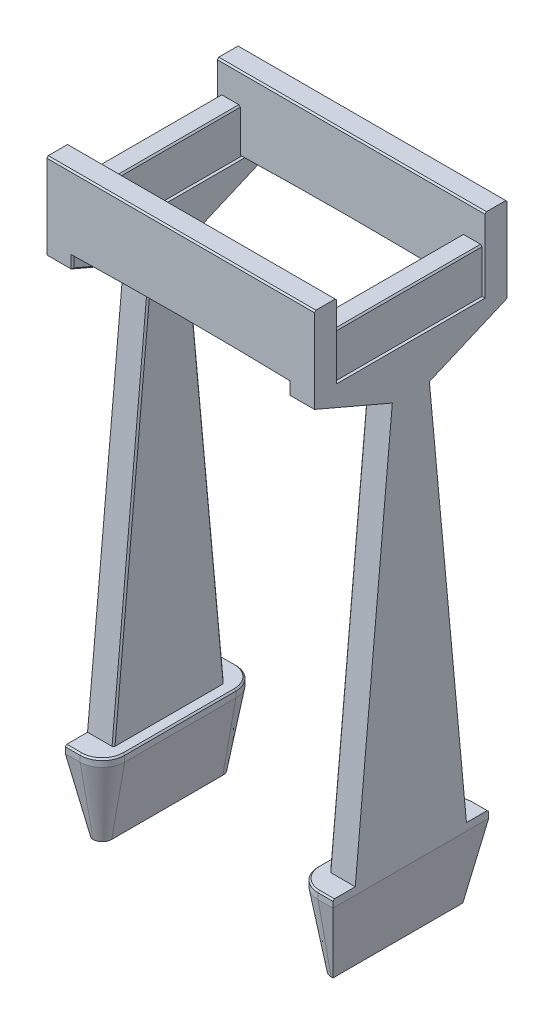
from build123d import *

# Parameters (mm, degrees)
BOSS_EXTRUDE1_DEPTH           = 30
SKETCH2_W                     = 26.926999998
SKETCH2_H                     = 60
BOSS_EXTRUDE2_DEPTH           = 200
BOSS_EXTRUDE3_START           = 30
BOSS_EXTRUDE3_DEPTH           = 30
BOSS_EXTRUDE4_DEPTH           = 4.0365
BOSS_EXTRUDE4_DEPTH_BACK      = 30.9635
BOSS_EXTRUDE5_DEPTH           = 10
FILLET1_R                     = 30
SKETCH7_W                     = 260
SKETCH7_H                     = 710
CUT_EXTRUDE1_DEPTH            = 768.843643003
CHAMFER1_SIZE                 = 2
CHAMFER2_SIZE                 = 2
CHAMFER3_SIZE                 = 2
CHAMFER4_SIZE                 = 2
CHAMFER6_SIZE                 = 2
BOSS_EXTRUDE6_DEPTH           = 99
BOSS_EXTRUDE6_DRAFT           = 10
BOSS_EXTRUDE6_PROFILE_2_DEPTH = 99
BOSS_EXTRUDE6_PROFILE_2_DRAFT = 10


with BuildPart() as part:
    # Sketch1 → Boss-Extrude1 (new body)
    with BuildSketch(Plane.XY):
        with BuildLine():
            Line((0, 0), (361.02, 0))
            Line((361.02, 0), (361.02, -100))
            Line((361.02, -100), (326.02, -100))
            ThreePointArc((326.02, -100), (180.51, -98.235310481), (35, -100))
            Line((35, -100), (0, -100))
            Line((0, -100), (0, 0))
        make_face()
    extrude(amount=BOSS_EXTRUDE1_DEPTH)

    # Sketch2 → Boss-Extrude2 (add)
    with BuildSketch(Plane(origin=(0, 0, 0), x_dir=(-1, 0, 0), z_dir=(0, 0, -1))):
        with Locations((-343.52, -70)):
            Rectangle(SKETCH2_W, SKETCH2_H)
        with Locations((-17.5, -70)):
            Rectangle(SKETCH2_W, SKETCH2_H)
    extrude(amount=BOSS_EXTRUDE2_DEPTH)

    # Sketch3 → Boss-Extrude3 (add)
    with BuildSketch(Plane(origin=(0, 0, -200), x_dir=(-1, 0, 0), z_dir=(0, 0, -1)).offset(BOSS_EXTRUDE3_START)):
        with BuildLine():
            Line((0, -100), (0, 0))
            Line((0, 0), (-361.02, 0))
            Line((-361.02, 0), (-361.02, -100))
            Line((-361.02, -100), (-326.02, -100))
            ThreePointArc((-326.02, -100), (-180.51, -98.235310481), (-35, -100))
            Line((-35, -100), (0, -100))
        make_face()
    extrude(amount=-BOSS_EXTRUDE3_DEPTH)

    # Sketch5 → Boss-Extrude4 (add, two sides: drawn at the far end of the back side and taken through both)
    with BuildSketch(Plane.ZY.offset(-4.036500001).offset(-BOSS_EXTRUDE4_DEPTH_BACK)):
        Polygon((-200, -100), (0, -100), (30, -100), (30, -115), (-75, -160), (-25, -700), (-100, -700), (-175, -700), (-125, -160), (-230, -115), (-230, -100), align=None)
    extrude(amount=BOSS_EXTRUDE4_DEPTH + BOSS_EXTRUDE4_DEPTH_BACK)

    # Sketch6 → Boss-Extrude5 (add)
    with BuildSketch(Plane.XZ.offset(700)):
        Polygon((0, -25), (0, 5), (50, 5), (50, -205), (0, -205), (0, -175), align=None)
    extrude(amount=BOSS_EXTRUDE5_DEPTH)

    # Fillet1
    fillet1_edges = [part.edges().sort_by_distance(p)[0] for p in [
        (50, -705, -205),
        (50, -705, 5),
    ]]
    fillet(fillet1_edges, radius=FILLET1_R)

    # Sketch7 → Cut-Extrude1 (cut, through all)
    with BuildSketch(Plane(origin=(180.51, 0, 0), x_dir=(0, 0, -1), z_dir=(1, 0, 0))):
        with Locations((100, -355)):
            Rectangle(SKETCH7_W, SKETCH7_H)
    extrude(amount=CUT_EXTRUDE1_DEPTH, mode=Mode.SUBTRACT)

    # Mirror2: part across plane


with BuildPart() as part_1:
    add(part.part)
    add(part.part.mirror(Plane(origin=(180.51, 0, 0), x_dir=(0, 0, 1), z_dir=(1, 0, 0))))

    # Chamfer1
    chamfer1_edges = [part_1.edges().sort_by_distance(p)[0] for p in [
        (180.51, 0, 30),
        (180.51, 0, 0),
        (180.51, 0, -200),
        (180.51, 0, -230),
    ]]
    chamfer(chamfer1_edges, length=CHAMFER1_SIZE)

    # Chamfer2
    chamfer2_edges = [part_1.edges().sort_by_distance(p)[0] for p in [
        (356.983499999, -40, -100),
        (330.056500001, -40, -100),
        (4.036500001, -40, -100),
        (30.963499999, -40, -100),
    ]]
    chamfer(chamfer2_edges, length=CHAMFER2_SIZE)

    # Chamfer3
    chamfer3_edges = [part_1.edges().sort_by_distance(p)[0] for p in [
        (326.019999999, -107.5, -230),
        (326.019999999, -137.5, -177.5),
        (326.019999999, -430, -150),
        (326.019999999, -430, -50),
        (326.019999999, -137.5, -22.5),
        (326.019999999, -107.5, 30),
        (35.000000001, -107.5, 30),
        (35.000000001, -137.5, -22.5),
        (35.000000001, -430, -50),
        (35.000000001, -430, -150),
        (35.000000001, -137.5, -177.5),
        (35.000000001, -107.5, -230),
    ]]
    chamfer(chamfer3_edges, length=CHAMFER3_SIZE)

    # Chamfer4
    chamfer4_edges = [part_1.edges().sort_by_distance(p)[0] for p in [
        (50, -700, -100),
        (10, -700, 5),
        (41.213203436, -700, -3.786796564),
        (41.213203436, -700, -196.213203436),
        (311.02, -700, -100),
        (351.02, -700, 5),
        (351.02, -700, -205),
        (319.806796564, -700, -196.213203436),
        (319.806796564, -700, -3.786796564),
        (10, -700, -205),
    ]]
    chamfer(chamfer4_edges, length=CHAMFER4_SIZE)

    # Chamfer6
    # the kernel refuses this chamfer: 2 mm, written as the material it takes off along each edge
    with BuildSketch(Plane(origin=(180.51, -6098.235310479, 30), x_dir=(0.025441959758898923, 0.9996763009512762, 0), z_dir=(0.9996763009512762, -0.025441959758898923, 0))) as chamfer6_piece_1_section:
        Polygon((5999.999999998 + CHAMFER6_SIZE, 0), (5999.999999998, -CHAMFER6_SIZE), (5999.999999998, 0), align=None)
    chamfer6_piece_1 = revolve(axis=Axis((180.51, -6098.235310479, 30), (0, 0, 1)), revolution_arc=2.915748449, mode=Mode.PRIVATE)
    chamfer6_piece_1 = split(chamfer6_piece_1, bisect_by=Plane(origin=(327.145000629, -99.268037673, 29.12500063), z_dir=(-0.7071067811865476, 0, 0.7071067811865476)), keep=Keep.TOP, mode=Mode.PRIVATE)
    chamfer6_piece_1 = split(chamfer6_piece_1, bisect_by=Plane(origin=(180.135000332, -99.268037673, -117.135000331), z_dir=(0.7071067811865476, 0, 0.7071067811865476)), keep=Keep.TOP, mode=Mode.PRIVATE)
    add(chamfer6_piece_1, mode=Mode.SUBTRACT)
    with BuildSketch(Plane(origin=(180.51, -6098.235310479, 0), x_dir=(0.02510863351858876, 0.9996847285633752, 0), z_dir=(0.9996847285633752, -0.02510863351858876, 0))) as chamfer6_piece_2_section:
        Polygon((5999.999999998 + CHAMFER6_SIZE, 0), (5999.999999998, CHAMFER6_SIZE), (5999.999999998, 0), align=None)
    chamfer6_piece_2 = revolve(axis=Axis((180.51, -6098.235310479, 0), (0, 0, 1)), revolution_arc=2.877539868, mode=Mode.PRIVATE)
    chamfer6_piece_2 = split(chamfer6_piece_2, bisect_by=Plane(origin=(328.004034253, -100, 0.650481022), z_dir=(0, 1, 0)), keep=Keep.TOP, mode=Mode.PRIVATE)
    chamfer6_piece_2 = split(chamfer6_piece_2, bisect_by=Plane(origin=(330.056500001, -99.349322449, 0.650481022), z_dir=(-1, 0, 0)), keep=Keep.TOP, mode=Mode.PRIVATE)
    chamfer6_piece_2 = split(chamfer6_piece_2, bisect_by=Plane(origin=(30.963499999, -99.349322449, 0.650481022), z_dir=(1, 0, 0)), keep=Keep.TOP, mode=Mode.PRIVATE)
    add(chamfer6_piece_2, mode=Mode.SUBTRACT)
    with BuildSketch(Plane(origin=(180.51, -6098.235310479, -200), x_dir=(-0.025108633518586027, 0.9996847285633753, 0), z_dir=(-0.9996847285633753, -0.025108633518586027, 0))) as chamfer6_piece_3_section:
        Polygon((5999.999999998 + CHAMFER6_SIZE, 0), (5999.999999998, CHAMFER6_SIZE), (5999.999999998, 0), align=None)
    chamfer6_piece_3 = revolve(axis=Axis((180.51, -6098.235310479, -200), (0, 0, -1)), revolution_arc=2.877539868, mode=Mode.PRIVATE)
    chamfer6_piece_3 = split(chamfer6_piece_3, bisect_by=Plane(origin=(33.015965747, -100, -200.650481022), z_dir=(0, 1, 0)), keep=Keep.TOP, mode=Mode.PRIVATE)
    chamfer6_piece_3 = split(chamfer6_piece_3, bisect_by=Plane(origin=(330.056500001, -99.349322449, -200.650481022), z_dir=(-1, 0, 0)), keep=Keep.TOP, mode=Mode.PRIVATE)
    chamfer6_piece_3 = split(chamfer6_piece_3, bisect_by=Plane(origin=(30.963499999, -99.349322449, -200.650481022), z_dir=(1, 0, 0)), keep=Keep.TOP, mode=Mode.PRIVATE)
    add(chamfer6_piece_3, mode=Mode.SUBTRACT)
    with BuildSketch(Plane(origin=(180.51, -6098.235310479, -230), x_dir=(-0.025441959758894937, 0.9996763009512762, 0), z_dir=(-0.9996763009512762, -0.025441959758894937, 0))) as chamfer6_piece_4_section:
        Polygon((5999.999999998 + CHAMFER6_SIZE, 0), (5999.999999998, -CHAMFER6_SIZE), (5999.999999998, 0), align=None)
    chamfer6_piece_4 = revolve(axis=Axis((180.51, -6098.235310479, -230), (0, 0, -1)), revolution_arc=2.915748449, mode=Mode.PRIVATE)
    chamfer6_piece_4 = split(chamfer6_piece_4, bisect_by=Plane(origin=(180.884999668, -99.268037673, -82.864999669), z_dir=(-0.7071067811865476, 0, -0.7071067811865476)), keep=Keep.TOP, mode=Mode.PRIVATE)
    chamfer6_piece_4 = split(chamfer6_piece_4, bisect_by=Plane(origin=(33.874999371, -99.268037673, -229.12500063), z_dir=(0.7071067811865476, 0, -0.7071067811865476)), keep=Keep.TOP, mode=Mode.PRIVATE)
    add(chamfer6_piece_4, mode=Mode.SUBTRACT)


with BuildPart() as boss_extrude6_tool:
    # Sketch10 → Boss-Extrude6 (with draft: the straight prism first)
    with BuildSketch(Plane.XZ.offset(710)):
        with BuildLine():
            Line((341.02, -205), (361.02, -205))
            Line((361.02, -205), (361.02, 5))
            Line((361.02, 5), (341.02, 5))
            ThreePointArc((341.02, 5), (319.806796564, -3.786796564), (311.02, -25))
            Line((311.02, -25), (311.02, -175))
            ThreePointArc((311.02, -175), (319.806796564, -196.213203436), (341.02, -205))
        make_face()
    extrude(amount=BOSS_EXTRUDE6_DEPTH)
    # Boss-Extrude6: the draft: its side faces are tilted about the plane it starts from
    boss_extrude6_sides = [boss_extrude6_tool.faces().sort_by_distance(p)[0] for p in [
        (351.02, -759.5, -205),
        (361.02, -759.5, -100),
        (351.02, -759.5, 5),
        (319.806796564, -759.5, -3.786796564),
        (311.02, -759.5, -100),
        (319.806796564, -759.5, -196.213203436),
    ]]
    draft(boss_extrude6_sides, Plane.XZ.offset(710), BOSS_EXTRUDE6_DRAFT)


with BuildPart() as part_2:
    add(part_1.part)

    # Boss-Extrude6: add boss_extrude6_tool
    add(boss_extrude6_tool.part)


with BuildPart() as boss_extrude6_profile_2_tool:
    # Sketch10 → Boss-Extrude6 profile 2 (with draft: the straight prism first)
    with BuildSketch(Plane.XZ.offset(710)):
        with BuildLine():
            Line((0, -205), (20, -205))
            ThreePointArc((20, -205), (41.213203436, -196.213203436), (50, -175))
            Line((50, -175), (50, -25))
            ThreePointArc((50, -25), (41.213203436, -3.786796564), (20, 5))
            Line((20, 5), (0, 5))
            Line((0, 5), (0, -205))
        make_face()
    extrude(amount=BOSS_EXTRUDE6_PROFILE_2_DEPTH)
    # Boss-Extrude6 profile 2: the draft: its side faces are tilted about the plane it starts from
    boss_extrude6_profile_2_sides = [boss_extrude6_profile_2_tool.faces().sort_by_distance(p)[0] for p in [
        (10, -759.5, -205),
        (41.213203436, -759.5, -196.213203436),
        (50, -759.5, -100),
        (41.213203436, -759.5, -3.786796564),
        (10, -759.5, 5),
        (0, -759.5, -100),
    ]]
    draft(boss_extrude6_profile_2_sides, Plane.XZ.offset(710), BOSS_EXTRUDE6_PROFILE_2_DRAFT)


with BuildPart() as part_3:
    add(part_2.part)

    # Boss-Extrude6 profile 2: add boss_extrude6_profile_2_tool
    add(boss_extrude6_profile_2_tool.part)


solid = part_3.part
